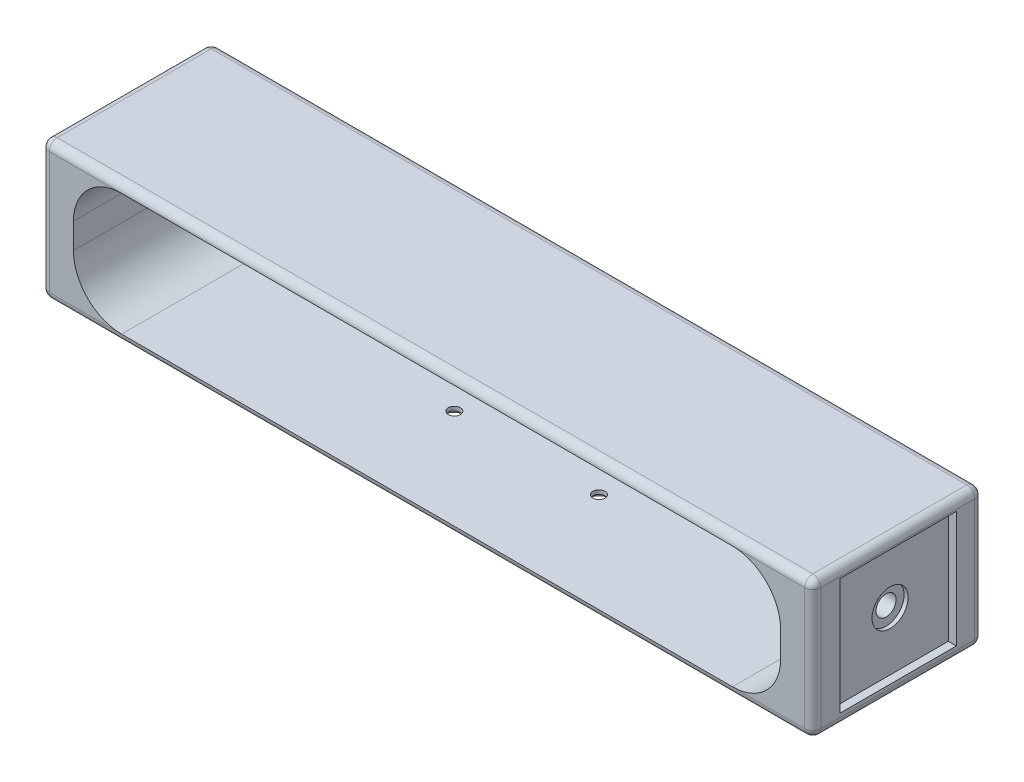
from build123d import *

# Parameters (mm, degrees)
SKETCH1_W           = 192
SKETCH1_H           = 42.3
BOSS_EXTRUDE1_DEPTH = 2
SKETCH2_W           = 176
SKETCH2_H           = 2
BOSS_EXTRUDE2_DEPTH = 30.35
SKETCH3_W           = 192
SKETCH3_H           = 42.3
BOSS_EXTRUDE3_DEPTH = 2
FILLET1_R           = 12
FILLET2_R           = 12
FILLET3_R           = 12
FILLET4_R           = 12
CUT_EXTRUDE1_DEPTH  = 2
CUT_EXTRUDE2_DEPTH  = 2
SKETCH6_R           = 4
BOSS_EXTRUDE5_DEPTH = 6
SKETCH7_R           = 2.25
CUT_EXTRUDE3_DEPTH  = 10
SKETCH8_W           = 1.5
SKETCH8_H           = 9.217326718
CUT_EXTRUDE4_DEPTH  = 6
SKETCH10_R          = 1.5
CUT_EXTRUDE9_DEPTH  = 6
FILLET5_R           = 2
FILLET6_R           = 2
FILLET9_R           = 2
FILLET10_R          = 2
FILLET11_R          = 2
FILLET14_R          = 1
FILLET15_R          = 1
SKETCH11_R          = 2.5
CUT_EXTRUDE11_DEPTH = 1
SKETCH12_R          = 4.5
CUT_EXTRUDE12_DEPTH = 1
SKETCH13_R          = 2.5
CUT_EXTRUDE14_DEPTH = 10
SKETCH14_W          = 29
SKETCH14_H          = 29
CUT_EXTRUDE15_DEPTH = 2
SKETCH15_R          = 4.5
CUT_EXTRUDE16_DEPTH = 1
FILLET16_R          = 0.5
FILLET17_R          = 0.5
SKETCH16_W          = 8
SKETCH16_H          = 30.35
CUT_EXTRUDE17_DEPTH = 80
FILLET18_R          = 2
FILLET19_R          = 2


with BuildPart() as part:
    # Sketch1 → Boss-Extrude1 (new body)
    with BuildSketch(Plane(origin=(0, 0, 0), x_dir=(1, 0, 0), z_dir=(0, 1, 0))):
        Rectangle(SKETCH1_W, SKETCH1_H)
    extrude(amount=BOSS_EXTRUDE1_DEPTH)

    # Sketch2 → Boss-Extrude2 (add)
    with BuildSketch(Plane(origin=(0, 2, 0), x_dir=(1, 0, 0), z_dir=(0, 1, 0))):
        Polygon((-96, 21.15), (-96, -21.15), (-88, -21.15), (-88, 19.15), (-88, 21.15), align=None)
        with Locations((0, 20.15)):
            Rectangle(SKETCH2_W, SKETCH2_H)
        Polygon((88, 19.15), (88, -21.15), (96, -21.15), (96, 21.15), (88, 21.15), align=None)
    extrude(amount=BOSS_EXTRUDE2_DEPTH)

    # Sketch3 → Boss-Extrude3 (add)
    with BuildSketch(Plane(origin=(0, 32.35, 0), x_dir=(1, 0, 0), z_dir=(0, 1, 0))):
        Rectangle(SKETCH3_W, SKETCH3_H)
    extrude(amount=BOSS_EXTRUDE3_DEPTH)

    # Fillet1
    fillet1_edges = [part.edges().sort_by_distance(p)[0] for p in [
        (-88, 32.35, 1),
    ]]
    fillet(fillet1_edges, radius=FILLET1_R)

    # Fillet2
    fillet2_edges = [part.edges().sort_by_distance(p)[0] for p in [
        (-88, 2, 1),
    ]]
    fillet(fillet2_edges, radius=FILLET2_R)

    # Fillet3
    fillet3_edges = [part.edges().sort_by_distance(p)[0] for p in [
        (88, 32.35, 1),
    ]]
    fillet(fillet3_edges, radius=FILLET3_R)

    # Fillet4
    fillet4_edges = [part.edges().sort_by_distance(p)[0] for p in [
        (88, 2, 1),
    ]]
    fillet(fillet4_edges, radius=FILLET4_R)

    # Sketch4 → Cut-Extrude1 (cut)
    with BuildSketch(Plane.XY.offset(-19.15)):
        with BuildLine():
            Line((-76, 32.35), (-88, 20.35))
            ThreePointArc((-88, 20.35), (-84.485281374, 28.835281374), (-76, 32.35))
        make_face()
        with BuildLine():
            Line((-88, 14), (-76, 2))
            ThreePointArc((-76, 2), (-84.485281374, 5.514718626), (-88, 14))
        make_face()
        Polygon((-76, 32.35), (-88, 20.35), (-88, 14), (-76, 2), (-26, 2), (-26, 32.35), align=None)
    extrude(amount=-CUT_EXTRUDE1_DEPTH, mode=Mode.SUBTRACT)

    # Sketch5 → Cut-Extrude2 (cut)
    with BuildSketch(Plane.XY.offset(-19.15)):
        Polygon((88, 20.35), (76, 32.35), (26, 32.35), (26, 2), (76, 2), (88, 14), align=None)
        with BuildLine():
            Line((88, 20.35), (76, 32.35))
            ThreePointArc((76, 32.35), (84.485281374, 28.835281374), (88, 20.35))
        make_face()
        with BuildLine():
            Line((76, 2), (88, 14))
            ThreePointArc((88, 14), (84.485281374, 5.514718626), (76, 2))
        make_face()
    extrude(amount=-CUT_EXTRUDE2_DEPTH, mode=Mode.SUBTRACT)

    # Sketch6 → Boss-Extrude5 (add)
    with BuildSketch(Plane.ZY.offset(96)):
        with Locations(Location((0, 17.175, 0), (0, 0, 180))):
            Circle(SKETCH6_R)
    extrude(amount=BOSS_EXTRUDE5_DEPTH)

    # Sketch7 → Cut-Extrude3 (cut)
    with BuildSketch(Plane.ZY.offset(102)):
        with Locations((0, 17.175)):
            Circle(SKETCH7_R)
    extrude(amount=-CUT_EXTRUDE3_DEPTH, mode=Mode.SUBTRACT)

    # Sketch8 → Cut-Extrude4 (cut)
    with BuildSketch(Plane.ZY.offset(102)):
        with Locations((0, 17.175)):
            Rectangle(SKETCH8_W, SKETCH8_H)
    extrude(amount=-CUT_EXTRUDE4_DEPTH, mode=Mode.SUBTRACT)

    # Sketch10 → Cut-Extrude9 (cut)
    with BuildSketch(Plane.XZ):
        with Locations(Location((-18.002866527, -3.655663128, 0), (0, 0, 270))):
            Circle(SKETCH10_R)
        with Locations(Location((17.997133473, -3.655663128, 0), (0, 0, 270))):
            Circle(SKETCH10_R)
    extrude(amount=-CUT_EXTRUDE9_DEPTH, mode=Mode.SUBTRACT)

    # Fillet5
    fillet5_edges = [part.edges().sort_by_distance(p)[0] for p in [
        (0, 0, -21.15),
    ]]
    fillet(fillet5_edges, radius=FILLET5_R - 0.0001)  # a hair under: the kernel refuses the full size

    # Fillet6
    fillet6_edges = [part.edges().sort_by_distance(p)[0] for p in [
        (0, 34.35, -21.15),
    ]]
    fillet(fillet6_edges, radius=FILLET6_R - 0.0001)  # a hair under: the kernel refuses the full size

    # Fillet9
    fillet9_edges = [part.edges().sort_by_distance(p)[0] for p in [
        (96, 0.585757148, -20.564242852),
        (96, 17.175, -21.15),
        (96, 33.764242852, -20.564242852),
        (96, 34.35, 0.99995),
        (96, 0, 0.99995),
    ]]
    fillet(fillet9_edges, radius=FILLET9_R - 0.0001)  # a hair under: the kernel refuses the full size

    # Fillet10
    fillet10_edges = [part.edges().sort_by_distance(p)[0] for p in [
        (-96, 0, 0.99995),
        (-96, 0.585757148, -20.564242852),
        (-96, 34.35, 0.99995),
        (-96, 17.175, -21.15),
        (-96, 33.764242852, -20.564242852),
    ]]
    fillet(fillet10_edges, radius=FILLET10_R - 0.0001)  # a hair under: the kernel refuses the full size

    # Fillet11
    fillet11_edges = [part.edges().sort_by_distance(p)[0] for p in [
        (96, 17.175, 21.15),
        (95.414242852, 0.585757148, 21.15),
        (95.414242852, 33.764242852, 21.15),
        (0, 34.35, 21.15),
        (-96, 17.175, 21.15),
        (0, 0, 21.15),
        (-95.414242852, 0.585757148, 21.15),
        (-95.414242852, 33.764242852, 21.15),
    ]]
    fillet(fillet11_edges, radius=FILLET11_R - 0.0001)  # a hair under: the kernel refuses the full size

    # Fillet14
    fillet14_edges = [part.edges().sort_by_distance(p)[0] for p in [
        (-102, 17.175, 4),
    ]]
    fillet(fillet14_edges, radius=FILLET14_R)

    # Fillet15
    fillet15_edges = [part.edges().sort_by_distance(p)[0] for p in [
        (-102, 17.175, -4),
    ]]
    fillet(fillet15_edges, radius=FILLET15_R)

    # Sketch11 → Cut-Extrude11 (cut)
    with BuildSketch(Plane(origin=(0, 0, 0), x_dir=(-1, 0, 0), z_dir=(0, -1, 0))):
        with Locations(Location((18.002866527, 3.655663128, 0), (0, 0, 90))):
            Circle(SKETCH11_R)
        with Locations(Location((-17.997133473, 3.655663128, 0), (0, 0, 90))):
            Circle(SKETCH11_R)
    extrude(amount=-CUT_EXTRUDE11_DEPTH, mode=Mode.SUBTRACT)

    # Sketch12 → Cut-Extrude12 (cut)
    with BuildSketch(Plane(origin=(96, 0, 0), x_dir=(0, 0, -1), z_dir=(1, 0, 0))):
        with Locations((0.090844805, 17.432374702)):
            Circle(SKETCH12_R)
    extrude(amount=-CUT_EXTRUDE12_DEPTH, mode=Mode.SUBTRACT)

    # Sketch13 → Cut-Extrude14 (cut)
    with BuildSketch(Plane(origin=(96, 0, 0), x_dir=(0, 0, -1), z_dir=(1, 0, 0))):
        with Locations((0.090844805, 17.432374702)):
            Circle(SKETCH13_R)
    extrude(amount=-CUT_EXTRUDE14_DEPTH, mode=Mode.SUBTRACT)

    # Sketch14 → Cut-Extrude15 (cut)
    with BuildSketch(Plane(origin=(96, 0, 0), x_dir=(0, 0, -1), z_dir=(1, 0, 0))):
        with Locations((0.090844805, 17.432374702)):
            Rectangle(SKETCH14_W, SKETCH14_H)
    extrude(amount=-CUT_EXTRUDE15_DEPTH, mode=Mode.SUBTRACT)

    # Sketch15 → Cut-Extrude16 (cut)
    with BuildSketch(Plane(origin=(94, 0, 0), x_dir=(0, 0, -1), z_dir=(1, 0, 0))):
        with Locations((0.090844805, 17.432374702)):
            Circle(SKETCH15_R)
    extrude(amount=-CUT_EXTRUDE16_DEPTH, mode=Mode.SUBTRACT)

    # Fillet16
    fillet16_edges = [part.edges().sort_by_distance(p)[0] for p in [
        (-102, 18.474038106, 1.837117307),
    ]]
    fillet(fillet16_edges, radius=FILLET16_R)

    # Fillet17
    fillet17_edges = [part.edges().sort_by_distance(p)[0] for p in [
        (-102, 17.175, -2.25),
    ]]
    fillet(fillet17_edges, radius=FILLET17_R)

    # Sketch16 → Cut-Extrude17 (cut)
    with BuildSketch(Plane(origin=(0, 0, -21.15), x_dir=(-1, 0, 0), z_dir=(0, 0, -1))):
        with Locations((-22, 17.175)):
            Rectangle(SKETCH16_W, SKETCH16_H)
        with Locations((22, 17.175)):
            Rectangle(SKETCH16_W, SKETCH16_H)
    extrude(amount=-CUT_EXTRUDE17_DEPTH, mode=Mode.SUBTRACT)

    # Fillet18
    fillet18_edges = [part.edges().sort_by_distance(p)[0] for p in [
        (-18, 17.175, -21.15),
    ]]
    fillet(fillet18_edges, radius=FILLET18_R - 0.0001)  # a hair under: the kernel refuses the full size

    # Fillet19
    fillet19_edges = [part.edges().sort_by_distance(p)[0] for p in [
        (18, 17.175, -21.15),
    ]]
    fillet(fillet19_edges, radius=FILLET19_R - 0.0001)  # a hair under: the kernel refuses the full size


solid = part.part
